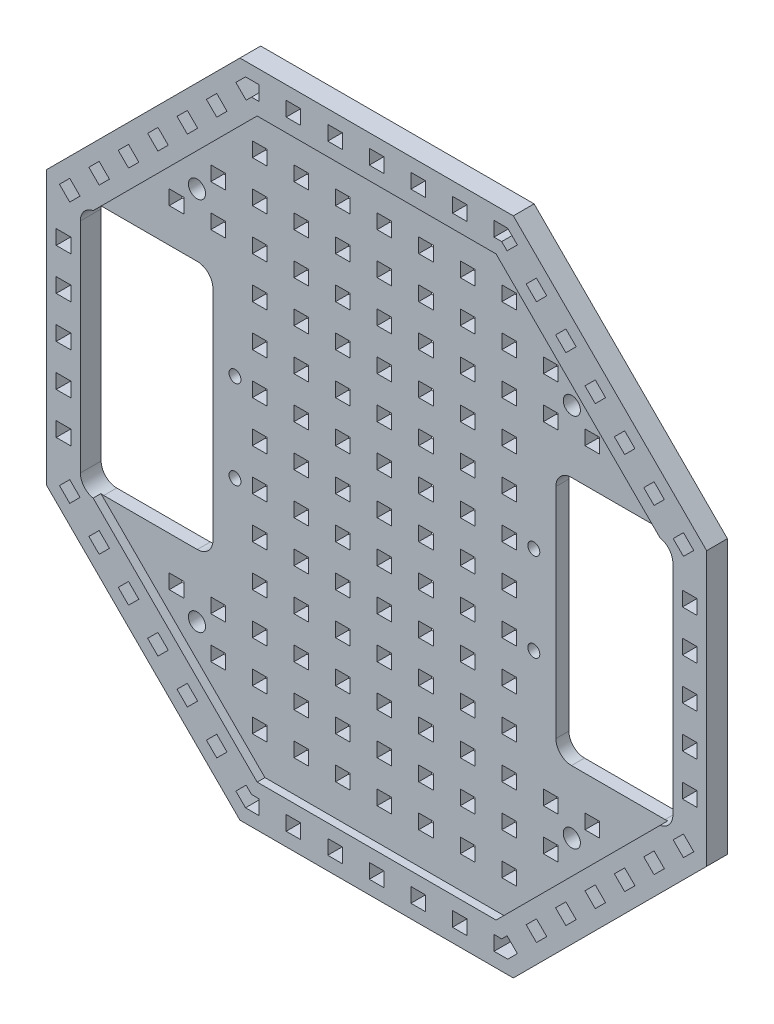
from build123d import *

# Parameters (mm, degrees)
RESSALTO_EXTRUS_O1_DEPTH = 2.5
ESBO_O2_R                = 1.15
CORTE_EXTRUS_O1_DEPTH    = 90.837353033
ESBO_O4_R                = 1.65
CORTE_EXTRUS_O2_DEPTH    = 40.5
RESSALTO_EXTRUS_O2_DEPTH = 1.5
ESBO_O6_W                = 2.8
ESBO_O6_H                = 2.8
CORTE_EXTRUS_O3_DEPTH    = 90.891601387


with BuildPart() as part:
    # Esboço1 → Ressalto-extrusão1 (new body)
    with BuildSketch(Plane.XY):
        Polygon((63.5, -26.302561211), (63.5, 26.302561211), (26.302561211, 63.5), (-26.302561211, 63.5), (-63.5, 26.302561211), (-63.5, -26.302561211), (-26.302561211, -63.5), (26.302561211, -63.5), align=None)
    extrude(amount=RESSALTO_EXTRUS_O1_DEPTH)

    # Esboço2 → Corte-extrusão1 (cut, through all)
    with BuildSketch(Plane(origin=(0, 0, 0), x_dir=(-1, 0, 0), z_dir=(0, 0, -1))):
        with Locations((28.75, 8.5)):
            Circle(ESBO_O2_R)
        with Locations((28.75, -8.5)):
            Circle(ESBO_O2_R)
        with Locations((-28.75, -8.5)):
            Circle(ESBO_O2_R)
        with Locations((-28.75, 8.5)):
            Circle(ESBO_O2_R)
        with BuildLine():
            Line((54, 24), (36, 24))
            ThreePointArc((36, 24), (33.878679656, 23.121320344), (33, 21))
            Line((33, 21), (33, -21))
            ThreePointArc((33, -21), (33.878679656, -23.121320344), (36, -24))
            Line((36, -24), (54, -24))
            ThreePointArc((54, -24), (56.121320344, -23.121320344), (57, -21))
            Line((57, -21), (57, 21))
            ThreePointArc((57, 21), (56.121320344, 23.121320344), (54, 24))
        make_face()
        with BuildLine():
            Line((-33, 21), (-33, -21))
            ThreePointArc((-33, -21), (-33.878679656, -23.121320344), (-36, -24))
            Line((-36, -24), (-54, -24))
            ThreePointArc((-54, -24), (-56.121320344, -23.121320344), (-57, -21))
            Line((-57, -21), (-57, 21))
            ThreePointArc((-57, 21), (-56.121320344, 23.121320344), (-54, 24))
            Line((-54, 24), (-36, 24))
            ThreePointArc((-36, 24), (-33.878679656, 23.121320344), (-33, 21))
        make_face()
    extrude(amount=-CORTE_EXTRUS_O1_DEPTH, mode=Mode.SUBTRACT)

    # Esboço4 → Corte-extrusão2 (cut)
    with BuildSketch(Plane(origin=(0, 0, 0), x_dir=(-1, 0, 0), z_dir=(0, 0, -1))):
        with Locations((36.062445841, -36.062445841)):
            Circle(ESBO_O4_R)
        with Locations((36.062445841, 36.062445841)):
            Circle(ESBO_O4_R)
        with Locations((-36.062445841, -36.062445841)):
            Circle(ESBO_O4_R)
        with Locations((-36.062445841, 36.062445841)):
            Circle(ESBO_O4_R)
    extrude(amount=-CORTE_EXTRUS_O2_DEPTH, mode=Mode.SUBTRACT)

    # Esboço5 → Ressalto-extrusão2 (add)
    with BuildSketch(Plane.XY.offset(2.5)):
        Polygon((26.302561211, -63.5), (63.5, -26.302561211), (63.5, 26.302561211), (26.302561211, 63.5), (-26.302561211, 63.5), (-63.5, 26.302561211), (-63.5, -26.302561211), (-26.302561211, -63.5), align=None)
        with BuildLine():
            Line((57, -21), (57, 21))
            ThreePointArc((57, 21), (56.3034887, 22.921962489), (54.537373462, 23.95147925))
            Line((54.537373462, 23.95147925), (22.988852712, 55.5))
            Line((22.988852712, 55.5), (-22.988852712, 55.5))
            Line((-22.988852712, 55.5), (-54.537373462, 23.95147925))
            ThreePointArc((-54.537373462, 23.95147925), (-56.3034887, 22.921962489), (-57, 21))
            Line((-57, 21), (-57, -21))
            ThreePointArc((-57, -21), (-56.3034887, -22.921962489), (-54.537373462, -23.95147925))
            Line((-54.537373462, -23.95147925), (-22.988852712, -55.5))
            Line((-22.988852712, -55.5), (22.988852712, -55.5))
            Line((22.988852712, -55.5), (54.537373462, -23.95147925))
            ThreePointArc((54.537373462, -23.95147925), (56.3034887, -22.921962489), (57, -21))
        make_face(mode=Mode.SUBTRACT)
    extrude(amount=RESSALTO_EXTRUS_O2_DEPTH)

    # Esboço6 → Corte-extrusão3 (cut, through all)
    with BuildSketch(Plane(origin=(0, 0, 0), x_dir=(-1, 0, 0), z_dir=(0, 0, -1))):
        Polygon((-47.72970773, -34.436100244), (-49.709606717, -36.415999231), (-47.72970773, -38.395898218), (-45.749808743, -36.415999231), align=None)
        Polygon((-42.072853481, -40.092954493), (-44.052752468, -42.072853481), (-42.072853481, -44.052752468), (-40.092954493, -42.072853481), align=None)
        Polygon((-53.38656198, -28.779245994), (-55.366460967, -30.759144982), (-53.38656198, -32.739043969), (-51.406662992, -30.759144982), align=None)
        Polygon((-59.043416229, -23.122391745), (-61.023315216, -25.102290732), (-59.043416229, -27.082189719), (-57.063517242, -25.102290732), align=None)
        Polygon((-25.225605949, -60.9), (-27.082189719, -59.043416229), (-25.102290732, -57.063517242), (-24.065807974, -58.1), (-22.6, -58.1), (-22.6, -60.9), align=None)
        with Locations((-60.25, -8)):
            Rectangle(ESBO_O6_W, ESBO_O6_H)
        Polygon((-30.759144982, -55.366460967), (-32.739043969, -53.38656198), (-30.759144982, -51.406662992), (-28.779245994, -53.38656198), align=None)
        Polygon((-36.415999231, -49.709606717), (-38.395898218, -47.72970773), (-36.415999231, -45.749808743), (-34.436100244, -47.72970773), align=None)
        with Locations((-8, -59.5)):
            Rectangle(ESBO_O6_W, ESBO_O6_H)
        with Locations((0, -59.5)):
            Rectangle(ESBO_O6_W, ESBO_O6_H)
        with Locations((-16, -59.5)):
            Rectangle(ESBO_O6_W, ESBO_O6_H)
        with Locations((-60.25, 0)):
            Rectangle(ESBO_O6_W, ESBO_O6_H)
        with Locations((8, 24)):
            Rectangle(ESBO_O6_W, ESBO_O6_H)
        with Locations((-60.25, -16)):
            Rectangle(ESBO_O6_W, ESBO_O6_H)
        with Locations((60.25, -16)):
            Rectangle(ESBO_O6_W, ESBO_O6_H)
        with Locations((60.25, -8)):
            Rectangle(ESBO_O6_W, ESBO_O6_H)
        Polygon((24.065807974, -58.1), (25.102290732, -57.063517242), (27.082189719, -59.043416229), (25.225605949, -60.9), (22.6, -60.9), (22.6, -58.1), align=None)
        with Locations((60.25, 0)):
            Rectangle(ESBO_O6_W, ESBO_O6_H)
        with Locations((16, -59.5)):
            Rectangle(ESBO_O6_W, ESBO_O6_H)
        with Locations((8, -59.5)):
            Rectangle(ESBO_O6_W, ESBO_O6_H)
        Polygon((34.436100244, -47.72970773), (36.415999231, -49.709606717), (38.395898218, -47.72970773), (36.415999231, -45.749808743), align=None)
        Polygon((40.092954493, -42.072853481), (42.072853481, -44.052752468), (44.052752468, -42.072853481), (42.072853481, -40.092954493), align=None)
        Polygon((28.779245994, -53.38656198), (30.759144982, -55.366460967), (32.739043969, -53.38656198), (30.759144982, -51.406662992), align=None)
        Polygon((61.023315216, -25.102290732), (59.043416229, -27.082189719), (57.063517242, -25.102290732), (59.043416229, -23.122391745), align=None)
        Polygon((55.366460967, -30.759144982), (53.38656198, -32.739043969), (51.406662992, -30.759144982), (53.38656198, -28.779245994), align=None)
        Polygon((49.709606717, -36.415999231), (47.72970773, -38.395898218), (45.749808743, -36.415999231), (47.72970773, -34.436100244), align=None)
        Polygon((47.72970773, 34.436100244), (49.709606717, 36.415999231), (47.72970773, 38.395898218), (45.749808743, 36.415999231), align=None)
        Polygon((42.072853481, 40.092954493), (44.052752468, 42.072853481), (42.072853481, 44.052752468), (40.092954493, 42.072853481), align=None)
        Polygon((53.38656198, 28.779245994), (55.366460967, 30.759144982), (53.38656198, 32.739043969), (51.406662992, 30.759144982), align=None)
        Polygon((59.043416229, 23.122391745), (61.023315216, 25.102290732), (59.043416229, 27.082189719), (57.063517242, 25.102290732), align=None)
        Polygon((25.225605949, 60.9), (27.082189719, 59.043416229), (25.102290732, 57.063517242), (24.065807974, 58.1), (22.6, 58.1), (22.6, 60.9), align=None)
        with Locations((60.25, 8)):
            Rectangle(ESBO_O6_W, ESBO_O6_H)
        Polygon((30.759144982, 55.366460967), (32.739043969, 53.38656198), (30.759144982, 51.406662992), (28.779245994, 53.38656198), align=None)
        Polygon((36.415999231, 49.709606717), (38.395898218, 47.72970773), (36.415999231, 45.749808743), (34.436100244, 47.72970773), align=None)
        with Locations((8, 59.5)):
            Rectangle(ESBO_O6_W, ESBO_O6_H)
        with Locations((16, 59.5)):
            Rectangle(ESBO_O6_W, ESBO_O6_H)
        with Locations((60.25, 16)):
            Rectangle(ESBO_O6_W, ESBO_O6_H)
        with Locations((-60.25, 16)):
            Rectangle(ESBO_O6_W, ESBO_O6_H)
        with Locations((-60.25, 8)):
            Rectangle(ESBO_O6_W, ESBO_O6_H)
        Polygon((-24.065807974, 58.1), (-25.102290732, 57.063517242), (-27.082189719, 59.043416229), (-25.225605949, 60.9), (-22.6, 60.9), (-22.6, 58.1), align=None)
        with Locations((-16, 59.5)):
            Rectangle(ESBO_O6_W, ESBO_O6_H)
        with Locations((-8, 59.5)):
            Rectangle(ESBO_O6_W, ESBO_O6_H)
        with Locations((0, 59.5)):
            Rectangle(ESBO_O6_W, ESBO_O6_H)
        Polygon((-34.436100244, 47.72970773), (-36.415999231, 49.709606717), (-38.395898218, 47.72970773), (-36.415999231, 45.749808743), align=None)
        Polygon((-40.092954493, 42.072853481), (-42.072853481, 44.052752468), (-44.052752468, 42.072853481), (-42.072853481, 40.092954493), align=None)
        Polygon((-28.779245994, 53.38656198), (-30.759144982, 55.366460967), (-32.739043969, 53.38656198), (-30.759144982, 51.406662992), align=None)
        Polygon((-61.023315216, 25.102290732), (-59.043416229, 27.082189719), (-57.063517242, 25.102290732), (-59.043416229, 23.122391745), align=None)
        Polygon((-55.366460967, 30.759144982), (-53.38656198, 32.739043969), (-51.406662992, 30.759144982), (-53.38656198, 28.779245994), align=None)
        Polygon((-49.709606717, 36.415999231), (-47.72970773, 38.395898218), (-45.749808743, 36.415999231), (-47.72970773, 34.436100244), align=None)
        Rectangle(ESBO_O6_W, ESBO_O6_H)
        with Locations((8, 0)):
            Rectangle(ESBO_O6_W, ESBO_O6_H)
        with Locations((16, 0)):
            Rectangle(ESBO_O6_W, ESBO_O6_H)
        with Locations((24, 0)):
            Rectangle(ESBO_O6_W, ESBO_O6_H)
        with Locations((-8, 24)):
            Rectangle(ESBO_O6_W, ESBO_O6_H)
        with Locations((-8, -24)):
            Rectangle(ESBO_O6_W, ESBO_O6_H)
        with Locations((8, -24)):
            Rectangle(ESBO_O6_W, ESBO_O6_H)
        with Locations((8, 8)):
            Rectangle(ESBO_O6_W, ESBO_O6_H)
        with Locations((16, 8)):
            Rectangle(ESBO_O6_W, ESBO_O6_H)
        with Locations((24, 8)):
            Rectangle(ESBO_O6_W, ESBO_O6_H)
        with Locations((8, 16)):
            Rectangle(ESBO_O6_W, ESBO_O6_H)
        with Locations((16, 16)):
            Rectangle(ESBO_O6_W, ESBO_O6_H)
        with Locations((24, 16)):
            Rectangle(ESBO_O6_W, ESBO_O6_H)
        with Locations((16, 24)):
            Rectangle(ESBO_O6_W, ESBO_O6_H)
        with Locations((24, 24)):
            Rectangle(ESBO_O6_W, ESBO_O6_H)
        with Locations((8, 32)):
            Rectangle(ESBO_O6_W, ESBO_O6_H)
        with Locations((16, 32)):
            Rectangle(ESBO_O6_W, ESBO_O6_H)
        with Locations((24, 32)):
            Rectangle(ESBO_O6_W, ESBO_O6_H)
        with Locations((32, 32)):
            Rectangle(ESBO_O6_W, ESBO_O6_H)
        with Locations((40, 32)):
            Rectangle(ESBO_O6_W, ESBO_O6_H)
        with Locations((8, 40)):
            Rectangle(ESBO_O6_W, ESBO_O6_H)
        with Locations((16, 40)):
            Rectangle(ESBO_O6_W, ESBO_O6_H)
        with Locations((24, 40)):
            Rectangle(ESBO_O6_W, ESBO_O6_H)
        with Locations((32, 40)):
            Rectangle(ESBO_O6_W, ESBO_O6_H)
        with Locations((8, 48)):
            Rectangle(ESBO_O6_W, ESBO_O6_H)
        with Locations((16, 48)):
            Rectangle(ESBO_O6_W, ESBO_O6_H)
        with Locations((24, 48)):
            Rectangle(ESBO_O6_W, ESBO_O6_H)
        with Locations((0, 8)):
            Rectangle(ESBO_O6_W, ESBO_O6_H)
        with Locations((0, 16)):
            Rectangle(ESBO_O6_W, ESBO_O6_H)
        with Locations((0, 24)):
            Rectangle(ESBO_O6_W, ESBO_O6_H)
        with Locations((0, 32)):
            Rectangle(ESBO_O6_W, ESBO_O6_H)
        with Locations((0, 40)):
            Rectangle(ESBO_O6_W, ESBO_O6_H)
        with Locations((0, 48)):
            Rectangle(ESBO_O6_W, ESBO_O6_H)
        with Locations((-24, 48)):
            Rectangle(ESBO_O6_W, ESBO_O6_H)
        with Locations((-16, 48)):
            Rectangle(ESBO_O6_W, ESBO_O6_H)
        with Locations((-8, 48)):
            Rectangle(ESBO_O6_W, ESBO_O6_H)
        with Locations((-32, 40)):
            Rectangle(ESBO_O6_W, ESBO_O6_H)
        with Locations((-24, 40)):
            Rectangle(ESBO_O6_W, ESBO_O6_H)
        with Locations((-16, 40)):
            Rectangle(ESBO_O6_W, ESBO_O6_H)
        with Locations((-8, 40)):
            Rectangle(ESBO_O6_W, ESBO_O6_H)
        with Locations((-40, 32)):
            Rectangle(ESBO_O6_W, ESBO_O6_H)
        with Locations((-32, 32)):
            Rectangle(ESBO_O6_W, ESBO_O6_H)
        with Locations((-24, 32)):
            Rectangle(ESBO_O6_W, ESBO_O6_H)
        with Locations((-16, 32)):
            Rectangle(ESBO_O6_W, ESBO_O6_H)
        with Locations((-8, 32)):
            Rectangle(ESBO_O6_W, ESBO_O6_H)
        with Locations((-24, 24)):
            Rectangle(ESBO_O6_W, ESBO_O6_H)
        with Locations((-16, 24)):
            Rectangle(ESBO_O6_W, ESBO_O6_H)
        with Locations((-24, 16)):
            Rectangle(ESBO_O6_W, ESBO_O6_H)
        with Locations((-16, 16)):
            Rectangle(ESBO_O6_W, ESBO_O6_H)
        with Locations((-8, 16)):
            Rectangle(ESBO_O6_W, ESBO_O6_H)
        with Locations((-24, 8)):
            Rectangle(ESBO_O6_W, ESBO_O6_H)
        with Locations((-16, 8)):
            Rectangle(ESBO_O6_W, ESBO_O6_H)
        with Locations((-8, 8)):
            Rectangle(ESBO_O6_W, ESBO_O6_H)
        with Locations((-24, 0)):
            Rectangle(ESBO_O6_W, ESBO_O6_H)
        with Locations((-16, 0)):
            Rectangle(ESBO_O6_W, ESBO_O6_H)
        with Locations((-8, 0)):
            Rectangle(ESBO_O6_W, ESBO_O6_H)
        with Locations((40, -32)):
            Rectangle(ESBO_O6_W, ESBO_O6_H)
        with Locations((-40, -32)):
            Rectangle(ESBO_O6_W, ESBO_O6_H)
        with Locations((-8, -8)):
            Rectangle(ESBO_O6_W, ESBO_O6_H)
        with Locations((-16, -8)):
            Rectangle(ESBO_O6_W, ESBO_O6_H)
        with Locations((-24, -8)):
            Rectangle(ESBO_O6_W, ESBO_O6_H)
        with Locations((-8, -16)):
            Rectangle(ESBO_O6_W, ESBO_O6_H)
        with Locations((-16, -16)):
            Rectangle(ESBO_O6_W, ESBO_O6_H)
        with Locations((-24, -16)):
            Rectangle(ESBO_O6_W, ESBO_O6_H)
        with Locations((-16, -24)):
            Rectangle(ESBO_O6_W, ESBO_O6_H)
        with Locations((-24, -24)):
            Rectangle(ESBO_O6_W, ESBO_O6_H)
        with Locations((-8, -32)):
            Rectangle(ESBO_O6_W, ESBO_O6_H)
        with Locations((-16, -32)):
            Rectangle(ESBO_O6_W, ESBO_O6_H)
        with Locations((-24, -32)):
            Rectangle(ESBO_O6_W, ESBO_O6_H)
        with Locations((-32, -32)):
            Rectangle(ESBO_O6_W, ESBO_O6_H)
        with Locations((-8, -40)):
            Rectangle(ESBO_O6_W, ESBO_O6_H)
        with Locations((-16, -40)):
            Rectangle(ESBO_O6_W, ESBO_O6_H)
        with Locations((-24, -40)):
            Rectangle(ESBO_O6_W, ESBO_O6_H)
        with Locations((-32, -40)):
            Rectangle(ESBO_O6_W, ESBO_O6_H)
        with Locations((-8, -48)):
            Rectangle(ESBO_O6_W, ESBO_O6_H)
        with Locations((-16, -48)):
            Rectangle(ESBO_O6_W, ESBO_O6_H)
        with Locations((-24, -48)):
            Rectangle(ESBO_O6_W, ESBO_O6_H)
        with Locations((0, -48)):
            Rectangle(ESBO_O6_W, ESBO_O6_H)
        with Locations((0, -40)):
            Rectangle(ESBO_O6_W, ESBO_O6_H)
        with Locations((0, -32)):
            Rectangle(ESBO_O6_W, ESBO_O6_H)
        with Locations((0, -24)):
            Rectangle(ESBO_O6_W, ESBO_O6_H)
        with Locations((0, -16)):
            Rectangle(ESBO_O6_W, ESBO_O6_H)
        with Locations((0, -8)):
            Rectangle(ESBO_O6_W, ESBO_O6_H)
        with Locations((24, -48)):
            Rectangle(ESBO_O6_W, ESBO_O6_H)
        with Locations((16, -48)):
            Rectangle(ESBO_O6_W, ESBO_O6_H)
        with Locations((8, -48)):
            Rectangle(ESBO_O6_W, ESBO_O6_H)
        with Locations((32, -40)):
            Rectangle(ESBO_O6_W, ESBO_O6_H)
        with Locations((24, -40)):
            Rectangle(ESBO_O6_W, ESBO_O6_H)
        with Locations((16, -40)):
            Rectangle(ESBO_O6_W, ESBO_O6_H)
        with Locations((8, -40)):
            Rectangle(ESBO_O6_W, ESBO_O6_H)
        with Locations((32, -32)):
            Rectangle(ESBO_O6_W, ESBO_O6_H)
        with Locations((24, -32)):
            Rectangle(ESBO_O6_W, ESBO_O6_H)
        with Locations((16, -32)):
            Rectangle(ESBO_O6_W, ESBO_O6_H)
        with Locations((8, -32)):
            Rectangle(ESBO_O6_W, ESBO_O6_H)
        with Locations((24, -24)):
            Rectangle(ESBO_O6_W, ESBO_O6_H)
        with Locations((16, -24)):
            Rectangle(ESBO_O6_W, ESBO_O6_H)
        with Locations((24, -16)):
            Rectangle(ESBO_O6_W, ESBO_O6_H)
        with Locations((16, -16)):
            Rectangle(ESBO_O6_W, ESBO_O6_H)
        with Locations((8, -16)):
            Rectangle(ESBO_O6_W, ESBO_O6_H)
        with Locations((24, -8)):
            Rectangle(ESBO_O6_W, ESBO_O6_H)
        with Locations((16, -8)):
            Rectangle(ESBO_O6_W, ESBO_O6_H)
        with Locations((8, -8)):
            Rectangle(ESBO_O6_W, ESBO_O6_H)
    extrude(amount=-CORTE_EXTRUS_O3_DEPTH, mode=Mode.SUBTRACT)


solid = part.part
